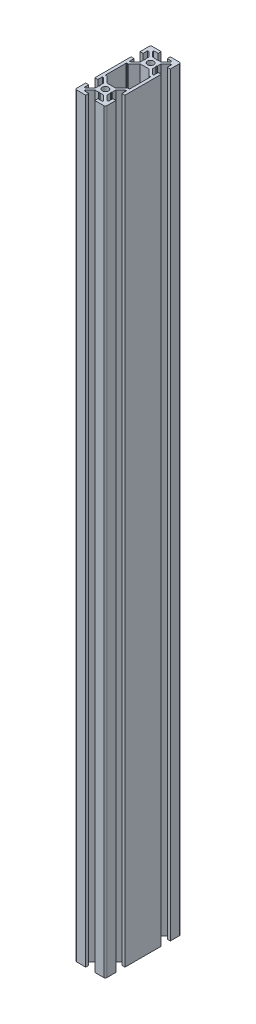
from build123d import *

# Parameters (mm, degrees)
BOSS_EXTRUDE3_DEPTH = 500


with BuildPart() as part:
    # Sketch3 → Boss-Extrude3 (new body)
    with BuildSketch(Plane(origin=(0, 0, 0), x_dir=(1, 0, 0), z_dir=(0, 1, 0))):
        with BuildLine():
            Line((-9.896646035, 17.017225661), (-9.896646035, -6.982774339))
            Line((-9.896646035, -6.982774339), (-7.896646035, -6.982774339))
            Line((-7.896646035, -6.982774339), (-7.896646035, -3.982774339))
            Line((-7.896646035, -3.982774339), (-6.957306206, -3.982774339))
            Line((-6.957306206, -3.982774339), (-3.896646035, -7.043434511))
            Line((-3.896646035, -7.043434511), (-3.896646035, -7.482774339))
            Line((-3.896646035, -7.482774339), (-3.896646035, -9.329184501))
            ThreePointArc((-3.896646035, -9.329184501), (-3.879608948, -9.458594023), (-3.829658737, -9.579184501))
            Line((-3.829658737, -9.579184501), (-3.596646035, -9.982774339))
            Line((-3.596646035, -9.982774339), (-3.829658737, -10.386364178))
            ThreePointArc((-3.829658737, -10.386364178), (-3.879608948, -10.506954655), (-3.896646035, -10.636364178))
            Line((-3.896646035, -10.636364178), (-3.896646035, -12.922114167))
            Line((-3.896646035, -12.922114167), (-6.957306206, -15.982774339))
            Line((-6.957306206, -15.982774339), (-7.896646035, -15.982774339))
            Line((-7.896646035, -15.982774339), (-7.896646035, -12.982774339))
            Line((-7.896646035, -12.982774339), (-9.896646035, -12.982774339))
            Line((-9.896646035, -12.982774339), (-9.896646035, -18.982774339))
            ThreePointArc((-9.896646035, -18.982774339), (-9.603752816, -19.68988112), (-8.896646035, -19.982774339))
            Line((-8.896646035, -19.982774339), (-2.896646035, -19.982774339))
            Line((-2.896646035, -19.982774339), (-2.896646035, -17.982774339))
            Line((-2.896646035, -17.982774339), (-5.896646035, -17.982774339))
            Line((-5.896646035, -17.982774339), (-5.896646035, -17.043434511))
            Line((-5.896646035, -17.043434511), (-2.835985863, -13.982774339))
            Line((-2.835985863, -13.982774339), (-2.396646035, -13.982774339))
            Line((-2.396646035, -13.982774339), (-0.550235873, -13.982774339))
            ThreePointArc((-0.550235873, -13.982774339), (-0.420826351, -13.965737252), (-0.300235873, -13.915787041))
            Line((-0.300235873, -13.915787041), (0.103353965, -13.682774339))
            Line((0.103353965, -13.682774339), (0.506943804, -13.915787041))
            ThreePointArc((0.506943804, -13.915787041), (0.627534281, -13.965737252), (0.756943804, -13.982774339))
            Line((0.756943804, -13.982774339), (3.042693794, -13.982774339))
            Line((3.042693794, -13.982774339), (6.103353965, -17.043434511))
            Line((6.103353965, -17.043434511), (6.103353965, -17.982774339))
            Line((6.103353965, -17.982774339), (3.103353965, -17.982774339))
            Line((3.103353965, -17.982774339), (3.103353965, -19.982774339))
            Line((3.103353965, -19.982774339), (9.103353965, -19.982774339))
            ThreePointArc((9.103353965, -19.982774339), (9.810460747, -19.68988112), (10.103353965, -18.982774339))
            Line((10.103353965, -18.982774339), (10.103353965, -12.982774339))
            Line((10.103353965, -12.982774339), (8.103353965, -12.982774339))
            Line((8.103353965, -12.982774339), (8.103353965, -15.982774339))
            Line((8.103353965, -15.982774339), (7.164014137, -15.982774339))
            Line((7.164014137, -15.982774339), (4.103353965, -12.922114167))
            Line((4.103353965, -12.922114167), (4.103353965, -12.482774339))
            Line((4.103353965, -12.482774339), (4.103353965, -10.636364178))
            ThreePointArc((4.103353965, -10.636364178), (4.086316879, -10.506954655), (4.036366667, -10.386364178))
            Line((4.036366667, -10.386364178), (3.803353965, -9.982774339))
            Line((3.803353965, -9.982774339), (4.036366667, -9.579184501))
            ThreePointArc((4.036366667, -9.579184501), (4.086316879, -9.458594023), (4.103353965, -9.329184501))
            Line((4.103353965, -9.329184501), (4.103353965, -7.043434511))
            Line((4.103353965, -7.043434511), (7.164014137, -3.982774339))
            Line((7.164014137, -3.982774339), (8.103353965, -3.982774339))
            Line((8.103353965, -3.982774339), (8.103353965, -6.982774339))
            Line((8.103353965, -6.982774339), (10.103353965, -6.982774339))
            Line((10.103353965, -6.982774339), (10.103353965, 17.017225661))
            Line((10.103353965, 17.017225661), (8.103353965, 17.017225661))
            Line((8.103353965, 17.017225661), (8.103353965, 14.017225661))
            Line((8.103353965, 14.017225661), (7.164014137, 14.017225661))
            Line((7.164014137, 14.017225661), (4.103353965, 17.077885833))
            Line((4.103353965, 17.077885833), (4.103353965, 19.363635822))
            ThreePointArc((4.103353965, 19.363635822), (4.086316879, 19.493045345), (4.036366667, 19.613635822))
            Line((4.036366667, 19.613635822), (3.803353965, 20.017225661))
            Line((3.803353965, 20.017225661), (4.036366667, 20.420815499))
            ThreePointArc((4.036366667, 20.420815499), (4.086316879, 20.541405977), (4.103353965, 20.670815499))
            Line((4.103353965, 20.670815499), (4.103353965, 22.517225661))
            Line((4.103353965, 22.517225661), (4.103353965, 22.956565489))
            Line((4.103353965, 22.956565489), (7.164014137, 26.017225661))
            Line((7.164014137, 26.017225661), (8.103353965, 26.017225661))
            Line((8.103353965, 26.017225661), (8.103353965, 23.017225661))
            Line((8.103353965, 23.017225661), (10.103353965, 23.017225661))
            Line((10.103353965, 23.017225661), (10.103353965, 29.017225661))
            ThreePointArc((10.103353965, 29.017225661), (9.810460747, 29.724332442), (9.103353965, 30.017225661))
            Line((9.103353965, 30.017225661), (3.103353965, 30.017225661))
            Line((3.103353965, 30.017225661), (3.103353965, 28.017225661))
            Line((3.103353965, 28.017225661), (6.103353965, 28.017225661))
            Line((6.103353965, 28.017225661), (6.103353965, 27.077885833))
            Line((6.103353965, 27.077885833), (3.042693794, 24.017225661))
            Line((3.042693794, 24.017225661), (0.756943804, 24.017225661))
            ThreePointArc((0.756943804, 24.017225661), (0.627534281, 24.000188574), (0.506943804, 23.950238363))
            Line((0.506943804, 23.950238363), (0.103353965, 23.717225661))
            Line((0.103353965, 23.717225661), (-0.300235873, 23.950238363))
            ThreePointArc((-0.300235873, 23.950238363), (-0.420826351, 24.000188574), (-0.550235873, 24.017225661))
            Line((-0.550235873, 24.017225661), (-2.396646035, 24.017225661))
            Line((-2.396646035, 24.017225661), (-2.835985863, 24.017225661))
            Line((-2.835985863, 24.017225661), (-5.896646035, 27.077885833))
            Line((-5.896646035, 27.077885833), (-5.896646035, 28.017225661))
            Line((-5.896646035, 28.017225661), (-2.896646035, 28.017225661))
            Line((-2.896646035, 28.017225661), (-2.896646035, 30.017225661))
            Line((-2.896646035, 30.017225661), (-8.896646035, 30.017225661))
            ThreePointArc((-8.896646035, 30.017225661), (-9.603752816, 29.724332442), (-9.896646035, 29.017225661))
            Line((-9.896646035, 29.017225661), (-9.896646035, 23.017225661))
            Line((-9.896646035, 23.017225661), (-7.896646035, 23.017225661))
            Line((-7.896646035, 23.017225661), (-7.896646035, 26.017225661))
            Line((-7.896646035, 26.017225661), (-6.957306206, 26.017225661))
            Line((-6.957306206, 26.017225661), (-3.896646035, 22.956565489))
            Line((-3.896646035, 22.956565489), (-3.896646035, 20.670815499))
            ThreePointArc((-3.896646035, 20.670815499), (-3.879608948, 20.541405977), (-3.829658737, 20.420815499))
            Line((-3.829658737, 20.420815499), (-3.596646035, 20.017225661))
            Line((-3.596646035, 20.017225661), (-3.829658737, 19.613635822))
            ThreePointArc((-3.829658737, 19.613635822), (-3.879608948, 19.493045345), (-3.896646035, 19.363635822))
            Line((-3.896646035, 19.363635822), (-3.896646035, 17.517225661))
            Line((-3.896646035, 17.517225661), (-3.896646035, 17.077885833))
            Line((-3.896646035, 17.077885833), (-6.957306206, 14.017225661))
            Line((-6.957306206, 14.017225661), (-7.896646035, 14.017225661))
            Line((-7.896646035, 14.017225661), (-7.896646035, 17.017225661))
            Line((-7.896646035, 17.017225661), (-9.896646035, 17.017225661))
        make_face()
        with BuildLine():
            Line((-6.960249932, 12.017225661), (-7.596646035, 12.017225661))
            ThreePointArc((-7.596646035, 12.017225661), (-7.808778069, 11.929357695), (-7.896646035, 11.717225661))
            Line((-7.896646035, 11.717225661), (-7.896646035, -1.682774339))
            ThreePointArc((-7.896646035, -1.682774339), (-7.808778069, -1.894906373), (-7.596646035, -1.982774339))
            Line((-7.596646035, -1.982774339), (-6.960249932, -1.982774339))
            ThreePointArc((-6.960249932, -1.982774339), (-6.845444902, -2.005610479), (-6.748117897, -2.070642305))
            Line((-6.748117897, -2.070642305), (-2.835985863, -5.982774339))
            Line((-2.835985863, -5.982774339), (3.042693794, -5.982774339))
            Line((3.042693794, -5.982774339), (6.954825828, -2.070642305))
            ThreePointArc((6.954825828, -2.070642305), (7.052152833, -2.005610479), (7.166957862, -1.982774339))
            Line((7.166957862, -1.982774339), (7.803353965, -1.982774339))
            ThreePointArc((7.803353965, -1.982774339), (8.015486, -1.894906373), (8.103353965, -1.682774339))
            Line((8.103353965, -1.682774339), (8.103353965, 11.717225661))
            ThreePointArc((8.103353965, 11.717225661), (8.015486, 11.929357695), (7.803353965, 12.017225661))
            Line((7.803353965, 12.017225661), (7.166957862, 12.017225661))
            ThreePointArc((7.166957862, 12.017225661), (7.052152833, 12.040061801), (6.954825828, 12.105093627))
            Line((6.954825828, 12.105093627), (3.042693794, 16.017225661))
            Line((3.042693794, 16.017225661), (-2.835985863, 16.017225661))
            Line((-2.835985863, 16.017225661), (-6.748117897, 12.105093627))
            ThreePointArc((-6.748117897, 12.105093627), (-6.845444902, 12.040061801), (-6.960249932, 12.017225661))
        make_face(mode=Mode.SUBTRACT)
        with BuildLine():
            ThreePointArc((-1.996646035, -9.982774339), (0.103353965, -12.082774339), (2.203353965, -9.982774339))
            ThreePointArc((2.203353965, -9.982774339), (0.103353965, -7.882774339), (-1.996646035, -9.982774339))
        make_face(mode=Mode.SUBTRACT)
        with BuildLine():
            ThreePointArc((-1.996646035, 20.017225661), (0.103353965, 17.917225661), (2.203353965, 20.017225661))
            ThreePointArc((2.203353965, 20.017225661), (0.103353965, 22.117225661), (-1.996646035, 20.017225661))
        make_face(mode=Mode.SUBTRACT)
    extrude(amount=BOSS_EXTRUDE3_DEPTH)


solid = part.part
